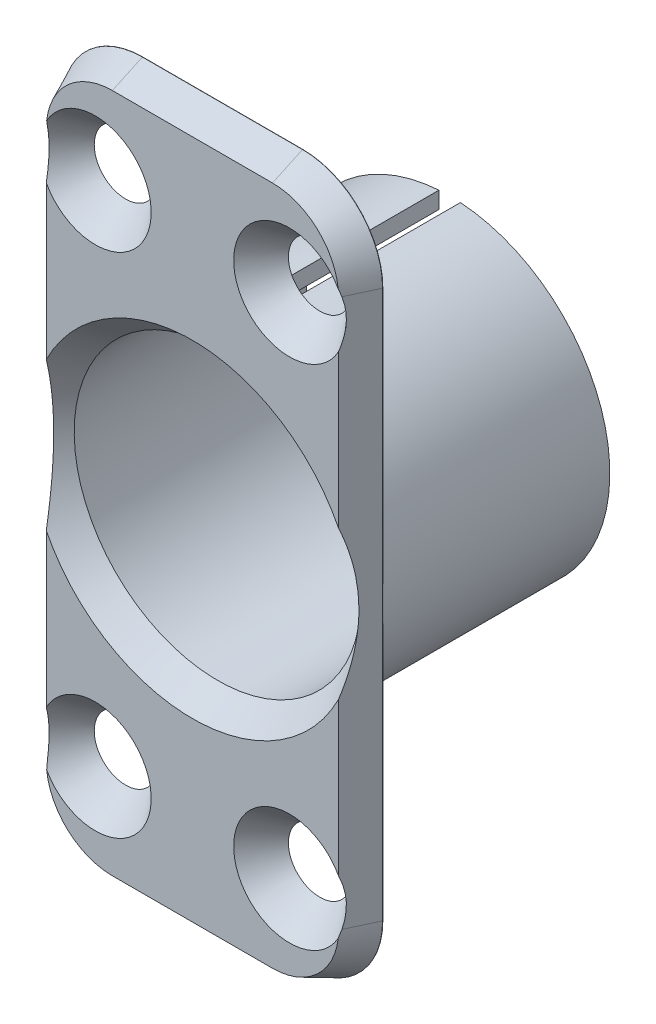
from build123d import *
from OCP.BRepFilletAPI import BRepFilletAPI_MakeChamfer

# Parameters (mm, degrees)
BOSS_EXTRUDE1_DEPTH = 2.4
SKETCH2_R           = 2
CUT_EXTRUDE1_DEPTH  = 31.907209919
CHAMFER1_SIZE       = 2.38
CHAMFER1_SIZE2      = 1.109812226
SKETCH3_R           = 12.7
SKETCH3_R_2         = 11.375
BOSS_EXTRUDE2_DEPTH = 18
CUT_EXTRUDE2_START  = -30
SKETCH4_R           = 11.375
CUT_EXTRUDE2_DEPTH  = 30
CHAMFER2_SIZE       = 2.4293521
CHAMFER2_SIZE_2     = 3
CHAMFER3_SIZE       = 1.619568066
CHAMFER3_SIZE_2     = 2
CUT_EXTRUDE3_DEPTH  = 37.954778273


with BuildPart() as part:
    # Sketch1 → Boss-Extrude1 (new body)
    with BuildSketch(Plane.XY):
        with BuildLine():
            Line((6.35, 28.075), (-6.35, 28.075))
            ThreePointArc((-6.35, 28.075), (-10.840128061, 26.215128061), (-12.7, 21.725))
            Line((-12.7, 21.725), (-12.7, -21.725))
            ThreePointArc((-12.7, -21.725), (-10.840128061, -26.215128061), (-6.35, -28.075))
            Line((-6.35, -28.075), (6.35, -28.075))
            ThreePointArc((6.35, -28.075), (10.840128061, -26.215128061), (12.7, -21.725))
            Line((12.7, -21.725), (12.7, 21.725))
            ThreePointArc((12.7, 21.725), (10.840128061, 26.215128061), (6.35, 28.075))
        make_face()
    extrude(amount=BOSS_EXTRUDE1_DEPTH)

    # Sketch2 → Cut-Extrude1 (cut, through all)
    with BuildSketch(Plane(origin=(0, 0, 0), x_dir=(-1, 0, 0), z_dir=(0, 0, -1))):
        with Locations((-7.7, 20.1248)):
            Circle(SKETCH2_R)
        with Locations((-7.7, -20.125)):
            Circle(SKETCH2_R)
        with Locations((7.7, 20.125)):
            Circle(SKETCH2_R)
        with Locations((7.7, -20.125)):
            Circle(SKETCH2_R)
    extrude(amount=-CUT_EXTRUDE1_DEPTH, mode=Mode.SUBTRACT)

    # Chamfer1: one chamfer whose edges measure the first distance from different faces: ONE call of the kernel's chamfer builder (chamfer() names one face for all edges)
    chamfer1_edges_1 = [part.edges().sort_by_distance(p)[0] for p in [
        (-10.840128061, 26.215128061, 2.4),
    ]]
    chamfer1_side_1 = [part.faces().sort_by_distance(p)[0] for p in [
        (-10.840128061, 26.215128061, 1.2),
    ]]
    chamfer1_edges_2 = [part.edges().sort_by_distance(p)[0] for p in [
        (-12.7, 0, 2.4),
    ]]
    chamfer1_side_2 = [part.faces().sort_by_distance(p)[0] for p in [
        (-12.7, 0, 1.2),
    ]]
    chamfer1_edges_3 = [part.edges().sort_by_distance(p)[0] for p in [
        (-10.840128061, -26.215128061, 2.4),
    ]]
    chamfer1_side_3 = [part.faces().sort_by_distance(p)[0] for p in [
        (-10.840128061, -26.215128061, 1.2),
    ]]
    chamfer1_edges_4 = [part.edges().sort_by_distance(p)[0] for p in [
        (0, -28.075, 2.4),
    ]]
    chamfer1_side_4 = [part.faces().sort_by_distance(p)[0] for p in [
        (0, -28.075, 1.2),
    ]]
    chamfer1_edges_5 = [part.edges().sort_by_distance(p)[0] for p in [
        (10.840128061, -26.215128061, 2.4),
    ]]
    chamfer1_side_5 = [part.faces().sort_by_distance(p)[0] for p in [
        (10.840128061, -26.215128061, 1.2),
    ]]
    chamfer1_edges_6 = [part.edges().sort_by_distance(p)[0] for p in [
        (12.7, 0, 2.4),
    ]]
    chamfer1_side_6 = [part.faces().sort_by_distance(p)[0] for p in [
        (12.7, 0, 1.2),
    ]]
    chamfer1_edges_7 = [part.edges().sort_by_distance(p)[0] for p in [
        (10.840128061, 26.215128061, 2.4),
    ]]
    chamfer1_side_7 = [part.faces().sort_by_distance(p)[0] for p in [
        (10.840128061, 26.215128061, 1.2),
    ]]
    chamfer1_edges_8 = [part.edges().sort_by_distance(p)[0] for p in [
        (0, 28.075, 2.4),
    ]]
    chamfer1_side_8 = [part.faces().sort_by_distance(p)[0] for p in [
        (0, 28.075, 1.2),
    ]]
    chamfer1 = BRepFilletAPI_MakeChamfer(part.part.solid().wrapped)
    for e in chamfer1_edges_1:
        chamfer1.Add(CHAMFER1_SIZE, CHAMFER1_SIZE2, e.wrapped, chamfer1_side_1[0].wrapped)  # the first distance lies on this face
    for e in chamfer1_edges_2:
        chamfer1.Add(CHAMFER1_SIZE, CHAMFER1_SIZE2, e.wrapped, chamfer1_side_2[0].wrapped)  # the first distance lies on this face
    for e in chamfer1_edges_3:
        chamfer1.Add(CHAMFER1_SIZE, CHAMFER1_SIZE2, e.wrapped, chamfer1_side_3[0].wrapped)  # the first distance lies on this face
    for e in chamfer1_edges_4:
        chamfer1.Add(CHAMFER1_SIZE, CHAMFER1_SIZE2, e.wrapped, chamfer1_side_4[0].wrapped)  # the first distance lies on this face
    for e in chamfer1_edges_5:
        chamfer1.Add(CHAMFER1_SIZE, CHAMFER1_SIZE2, e.wrapped, chamfer1_side_5[0].wrapped)  # the first distance lies on this face
    for e in chamfer1_edges_6:
        chamfer1.Add(CHAMFER1_SIZE, CHAMFER1_SIZE2, e.wrapped, chamfer1_side_6[0].wrapped)  # the first distance lies on this face
    for e in chamfer1_edges_7:
        chamfer1.Add(CHAMFER1_SIZE, CHAMFER1_SIZE2, e.wrapped, chamfer1_side_7[0].wrapped)  # the first distance lies on this face
    for e in chamfer1_edges_8:
        chamfer1.Add(CHAMFER1_SIZE, CHAMFER1_SIZE2, e.wrapped, chamfer1_side_8[0].wrapped)  # the first distance lies on this face
    add(Compound.cast(chamfer1.Shape()), mode=Mode.REPLACE)

    # Sketch3 → Boss-Extrude2 (add)
    with BuildSketch(Plane(origin=(0, 0, 0), x_dir=(-1, 0, 0), z_dir=(0, 0, -1))):
        Circle(SKETCH3_R)
        Circle(SKETCH3_R_2, mode=Mode.SUBTRACT)
    extrude(amount=BOSS_EXTRUDE2_DEPTH)

    # Sketch4 → Cut-Extrude2 (cut)
    with BuildSketch(Plane(origin=(0, 0, 0), x_dir=(-1, 0, 0), z_dir=(0, 0, -1)).offset(CUT_EXTRUDE2_START)):
        Circle(SKETCH4_R)
    extrude(amount=CUT_EXTRUDE2_DEPTH, mode=Mode.SUBTRACT)

    # Chamfer2
    # the kernel refuses this chamfer: 3, 2.4293521 mm, written as the material it takes off along each edge
    with BuildSketch(Plane(origin=(7.7, -20.125, 2.4), x_dir=(-1, 0, 0), z_dir=(0, -1, 0))) as chamfer2_piece_1:
        Polygon((2 + CHAMFER2_SIZE, 0), (2, CHAMFER2_SIZE_2), (2, 0), align=None)
    revolve(axis=Axis((7.7, -20.125, 2.4), (0, 0, -1)), mode=Mode.SUBTRACT)
    with BuildSketch(Plane(origin=(-7.7, -20.125, 2.4), x_dir=(-1, 0, 0), z_dir=(0, -1, 0))) as chamfer2_piece_2:
        Polygon((2 + CHAMFER2_SIZE, 0), (2, CHAMFER2_SIZE_2), (2, 0), align=None)
    revolve(axis=Axis((-7.7, -20.125, 2.4), (0, 0, -1)), mode=Mode.SUBTRACT)
    with BuildSketch(Plane(origin=(7.7, 20.1248, 2.4), x_dir=(-1, 0, 0), z_dir=(0, -1, 0))) as chamfer2_piece_3:
        Polygon((2 + CHAMFER2_SIZE, 0), (2, CHAMFER2_SIZE_2), (2, 0), align=None)
    revolve(axis=Axis((7.7, 20.1248, 2.4), (0, 0, -1)), mode=Mode.SUBTRACT)
    with BuildSketch(Plane(origin=(-7.7, 20.125, 2.4), x_dir=(-1, 0, 0), z_dir=(0, -1, 0))) as chamfer2_piece_4:
        Polygon((2 + CHAMFER2_SIZE, 0), (2, CHAMFER2_SIZE_2), (2, 0), align=None)
    revolve(axis=Axis((-7.7, 20.125, 2.4), (0, 0, -1)), mode=Mode.SUBTRACT)

    # Chamfer3
    # the kernel refuses this chamfer: 2, 1.619568066 mm, written as the material it takes off along each edge
    with BuildSketch(Plane(origin=(0, 0, 2.4), x_dir=(-1, 0, 0), z_dir=(0, 1, 0))) as chamfer3_piece_1:
        Polygon((11.375 + CHAMFER3_SIZE, 0), (11.375, -CHAMFER3_SIZE_2), (11.375, 0), align=None)
    revolve(axis=Axis((0, 0, 2.4), (0, 0, 1)), mode=Mode.SUBTRACT)

    # Sketch5 → Cut-Extrude3 (cut, through all)
    with BuildSketch(Plane(origin=(0, 0, -18), x_dir=(-1, 0, 0), z_dir=(0, 0, -1))):
        with BuildLine():
            Line((-0.85, 11.343197301), (-0.85, 12.75))
            Line((-0.85, 12.75), (0.85, 12.75))
            Line((0.85, 12.75), (0.85, 11.343197301))
            ThreePointArc((0.85, 11.343197301), (0, 11.375), (-0.85, 11.343197301))
        make_face()
    extrude(amount=-CUT_EXTRUDE3_DEPTH, mode=Mode.SUBTRACT)


solid = part.part
